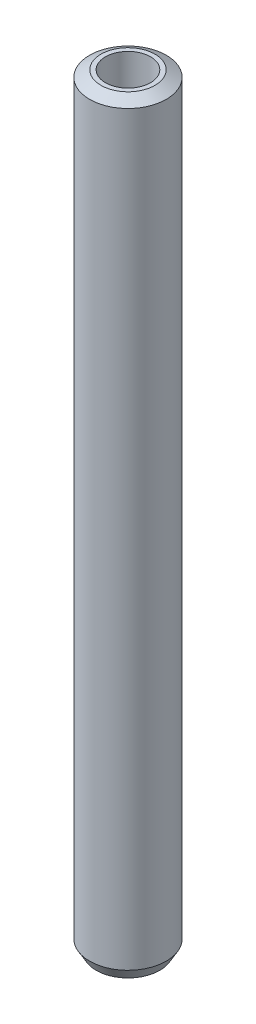
from build123d import *
from OCP.BRepFilletAPI import BRepFilletAPI_MakeChamfer

# Parameters (mm, degrees)
SKETCH1_R           = 30
BOSS_EXTRUDE1_DEPTH = 598.488150804
SKETCH2_R           = 17.641366552
CUT_EXTRUDE1_DEPTH  = 600.990055462
CHAMFER1_SIZE       = 5.100153286
CHAMFER1_SIZE2      = 8.833724618


with BuildPart() as part:
    # Sketch1 → Boss-Extrude1 (new body)
    with BuildSketch(Plane(origin=(0, 0, 0), x_dir=(1, 0, 0), z_dir=(0, 1, 0))):
        Circle(SKETCH1_R)
    extrude(amount=BOSS_EXTRUDE1_DEPTH)

    # Sketch2 → Cut-Extrude1 (cut, through all)
    with BuildSketch(Plane(origin=(0, 0, 0), x_dir=(1, 0, 0), z_dir=(0, 1, 0))):
        Circle(SKETCH2_R)
    extrude(amount=CUT_EXTRUDE1_DEPTH, mode=Mode.SUBTRACT)

    # Chamfer1: one chamfer whose edges measure the first distance from different faces: ONE call of the kernel's chamfer builder (chamfer() names one face for all edges)
    chamfer1_edges_1 = [part.edges().sort_by_distance(p)[0] for p in [
        (-30, 598.488150804, 0),
    ]]
    chamfer1_side_1 = [part.faces().sort_by_distance(p)[0] for p in [
        (-30, 299.244075402, 0),
    ]]
    chamfer1_edges_2 = [part.edges().sort_by_distance(p)[0] for p in [
        (-30, 0, 0),
    ]]
    chamfer1_side_2 = [part.faces().sort_by_distance(p)[0] for p in [
        (-29.151471863, 0, 0),
    ]]
    chamfer1 = BRepFilletAPI_MakeChamfer(part.part.solid().wrapped)
    for e in chamfer1_edges_1:
        chamfer1.Add(CHAMFER1_SIZE, CHAMFER1_SIZE2, e.wrapped, chamfer1_side_1[0].wrapped)  # the first distance lies on this face
    for e in chamfer1_edges_2:
        chamfer1.Add(CHAMFER1_SIZE, CHAMFER1_SIZE2, e.wrapped, chamfer1_side_2[0].wrapped)  # the first distance lies on this face
    add(Compound.cast(chamfer1.Shape()), mode=Mode.REPLACE)


solid = part.part
